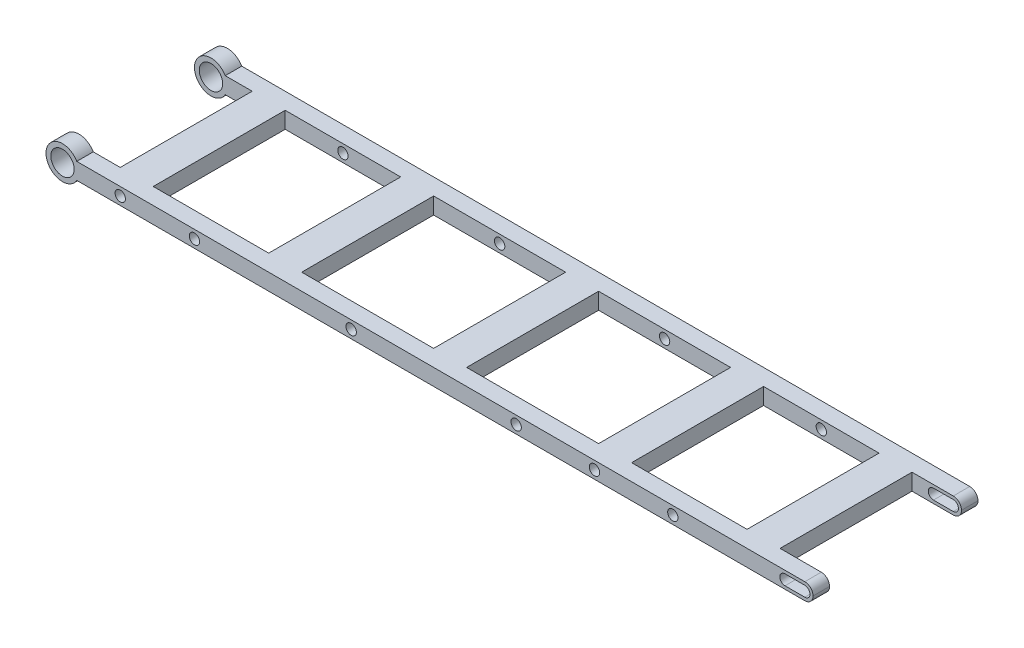
from build123d import *

# Parameters (mm, degrees)
SKETCH1_W           = 50.8
SKETCH1_H           = 50.8
SKETCH1_W_2         = 44.45
BOSS_EXTRUDE1_DEPTH = 6.35
FILLET2_R           = 3.175
SKETCH2_R           = 6.35
BOSS_EXTRUDE3_DEPTH = 6.35
BOSS_EXTRUDE4_START = -6.35
SKETCH4_R           = 6.35
BOSS_EXTRUDE4_DEPTH = 6.35
CUT_EXTRUDE1_REACH  = 164.453
SKETCH2_4_R         = 4.49961
SKETCH2_4_R_2       = 1.9939


with BuildPart() as part:
    # Sketch1 → Boss-Extrude1 (new body)
    with BuildSketch(Plane(origin=(0, 0, 0), x_dir=(1, 0, 0), z_dir=(0, 1, 0))):
        Polygon((-146.05, 25.4), (-127, 25.4), (-127, -25.4), (-146.05, -25.4), (-146.05, -31.75), (146.05, -31.75), (146.05, -25.4), (127, -25.4), (127, 25.4), (146.05, 25.4), (146.05, 31.75), (-146.05, 31.75), align=None)
        with Locations((-31.75, 0)):
            Rectangle(SKETCH1_W, SKETCH1_H, mode=Mode.SUBTRACT)
        with Locations((-92.075, 0)):
            Rectangle(SKETCH1_W_2, SKETCH1_H, mode=Mode.SUBTRACT)
        with Locations((31.75, 0)):
            Rectangle(SKETCH1_W, SKETCH1_H, mode=Mode.SUBTRACT)
        with Locations((92.075, 0)):
            Rectangle(SKETCH1_W_2, SKETCH1_H, mode=Mode.SUBTRACT)
    extrude(amount=-BOSS_EXTRUDE1_DEPTH)

    # Fillet2
    fillet2_edges = [part.edges().sort_by_distance(p)[0] for p in [
        (-146.05, -6.35, 28.575),
        (-146.05, 0, 28.575),
        (-146.05, -6.35, -28.575),
        (-146.05, 0, -28.575),
        (146.05, -6.35, -28.575),
        (146.05, 0, -28.575),
        (146.05, -6.35, 28.575),
        (146.05, 0, 28.575),
    ]]
    fillet(fillet2_edges, radius=FILLET2_R - 0.0001)  # a hair under: the kernel refuses the full size

    # Sketch2 → Boss-Extrude3 (add)
    with BuildSketch(Plane.XY.offset(31.75)):
        with Locations((-142.875, -3.175)):
            Circle(SKETCH2_R)
    extrude(amount=-BOSS_EXTRUDE3_DEPTH)

    # Sketch4 → Boss-Extrude4 (add)
    with BuildSketch(Plane(origin=(0, 0, -31.75), x_dir=(-1, 0, 0), z_dir=(0, 0, -1)).offset(BOSS_EXTRUDE4_START)):
        with Locations((142.875, -3.175)):
            Circle(SKETCH4_R)
    extrude(amount=BOSS_EXTRUDE4_DEPTH)

    # Cut-Extrude1: up to this face of the body (flat: up to its plane)
    cut_extrude1_end = Plane(part.part.faces().sort_by_distance((-5.43222234, -3.175, -31.75))[0])
    # Sketch2<4> → Cut-Extrude1 (cut, up to the picked face)
    with BuildSketch(Plane.XY.offset(31.75), mode=Mode.PRIVATE) as cut_extrude1_sk1:
        with Locations((-142.875, -3.175)):
            Circle(SKETCH2_4_R)
    cut_extrude1_tool1 = split(extrude(cut_extrude1_sk1.sketch, amount=-CUT_EXTRUDE1_REACH, mode=Mode.PRIVATE), bisect_by=cut_extrude1_end, keep=Keep.BOTH, mode=Mode.PRIVATE)
    # Sketch2<4> → Cut-Extrude1 (cut, up to the picked face)
    with BuildSketch(Plane.XY.offset(31.75), mode=Mode.PRIVATE) as cut_extrude1_sk2:
        with Locations((-92.075, -3.175)):
            Circle(SKETCH2_4_R_2)
    cut_extrude1_tool2 = split(extrude(cut_extrude1_sk2.sketch, amount=-CUT_EXTRUDE1_REACH, mode=Mode.PRIVATE), bisect_by=cut_extrude1_end, keep=Keep.BOTH, mode=Mode.PRIVATE)
    # Sketch2<4> → Cut-Extrude1 (cut, up to the picked face)
    with BuildSketch(Plane.XY.offset(31.75), mode=Mode.PRIVATE) as cut_extrude1_sk3:
        with Locations((-31.75, -3.175)):
            Circle(SKETCH2_4_R_2)
    cut_extrude1_tool3 = split(extrude(cut_extrude1_sk3.sketch, amount=-CUT_EXTRUDE1_REACH, mode=Mode.PRIVATE), bisect_by=cut_extrude1_end, keep=Keep.BOTH, mode=Mode.PRIVATE)
    # Sketch2<4> → Cut-Extrude1 (cut, up to the picked face)
    with BuildSketch(Plane.XY.offset(31.75), mode=Mode.PRIVATE) as cut_extrude1_sk4:
        with Locations((31.75, -3.175)):
            Circle(SKETCH2_4_R_2)
    cut_extrude1_tool4 = split(extrude(cut_extrude1_sk4.sketch, amount=-CUT_EXTRUDE1_REACH, mode=Mode.PRIVATE), bisect_by=cut_extrude1_end, keep=Keep.BOTH, mode=Mode.PRIVATE)
    # Sketch2<4> → Cut-Extrude1 (cut, up to the picked face)
    with BuildSketch(Plane.XY.offset(31.75), mode=Mode.PRIVATE) as cut_extrude1_sk5:
        with Locations((92.075, -3.175)):
            Circle(SKETCH2_4_R_2)
    cut_extrude1_tool5 = split(extrude(cut_extrude1_sk5.sketch, amount=-CUT_EXTRUDE1_REACH, mode=Mode.PRIVATE), bisect_by=cut_extrude1_end, keep=Keep.BOTH, mode=Mode.PRIVATE)
    # Sketch2<4> → Cut-Extrude1 (cut, up to the picked face)
    with BuildSketch(Plane.XY.offset(31.75), mode=Mode.PRIVATE) as cut_extrude1_sk6:
        with Locations((-120.65, -3.175)):
            Circle(SKETCH2_4_R_2)
    cut_extrude1_tool6 = split(extrude(cut_extrude1_sk6.sketch, amount=-CUT_EXTRUDE1_REACH, mode=Mode.PRIVATE), bisect_by=cut_extrude1_end, keep=Keep.BOTH, mode=Mode.PRIVATE)
    # Sketch2<4> → Cut-Extrude1 (cut, up to the picked face)
    with BuildSketch(Plane.XY.offset(31.75), mode=Mode.PRIVATE) as cut_extrude1_sk7:
        with Locations((61.9125, -3.175)):
            Circle(SKETCH2_4_R_2)
    cut_extrude1_tool7 = split(extrude(cut_extrude1_sk7.sketch, amount=-CUT_EXTRUDE1_REACH, mode=Mode.PRIVATE), bisect_by=cut_extrude1_end, keep=Keep.BOTH, mode=Mode.PRIVATE)
    # Sketch2<4> → Cut-Extrude1 (cut, up to the picked face)
    with BuildSketch(Plane.XY.offset(31.75), mode=Mode.PRIVATE) as cut_extrude1_sk8:
        with BuildLine():
            Line((135.255, -1.1811), (142.875, -1.1811))
            ThreePointArc((142.875, -1.1811), (144.8689, -3.175), (142.875, -5.1689))
            Line((142.875, -5.1689), (135.255, -5.1689))
            ThreePointArc((135.255, -5.1689), (133.2611, -3.175), (135.255, -1.1811))
        make_face()
    cut_extrude1_tool8 = split(extrude(cut_extrude1_sk8.sketch, amount=-CUT_EXTRUDE1_REACH, mode=Mode.PRIVATE), bisect_by=cut_extrude1_end, keep=Keep.BOTH, mode=Mode.PRIVATE)
    add(cut_extrude1_tool1.solids().sort_by(Axis((-142.875, -3.175, 31.75), (0, 0, -1)))[0], mode=Mode.SUBTRACT)
    add(cut_extrude1_tool2.solids().sort_by(Axis((-92.075, -3.175, 31.75), (0, 0, -1)))[0], mode=Mode.SUBTRACT)
    add(cut_extrude1_tool3.solids().sort_by(Axis((-31.75, -3.175, 31.75), (0, 0, -1)))[0], mode=Mode.SUBTRACT)
    add(cut_extrude1_tool4.solids().sort_by(Axis((31.75, -3.175, 31.75), (0, 0, -1)))[0], mode=Mode.SUBTRACT)
    add(cut_extrude1_tool5.solids().sort_by(Axis((92.075, -3.175, 31.75), (0, 0, -1)))[0], mode=Mode.SUBTRACT)
    add(cut_extrude1_tool6.solids().sort_by(Axis((-120.65, -3.175, 31.75), (0, 0, -1)))[0], mode=Mode.SUBTRACT)
    add(cut_extrude1_tool7.solids().sort_by(Axis((61.9125, -3.175, 31.75), (0, 0, -1)))[0], mode=Mode.SUBTRACT)
    add(cut_extrude1_tool8.solids().sort_by(Axis((139.065, -3.175, 31.75), (0, 0, -1)))[0], mode=Mode.SUBTRACT)


solid = part.part
